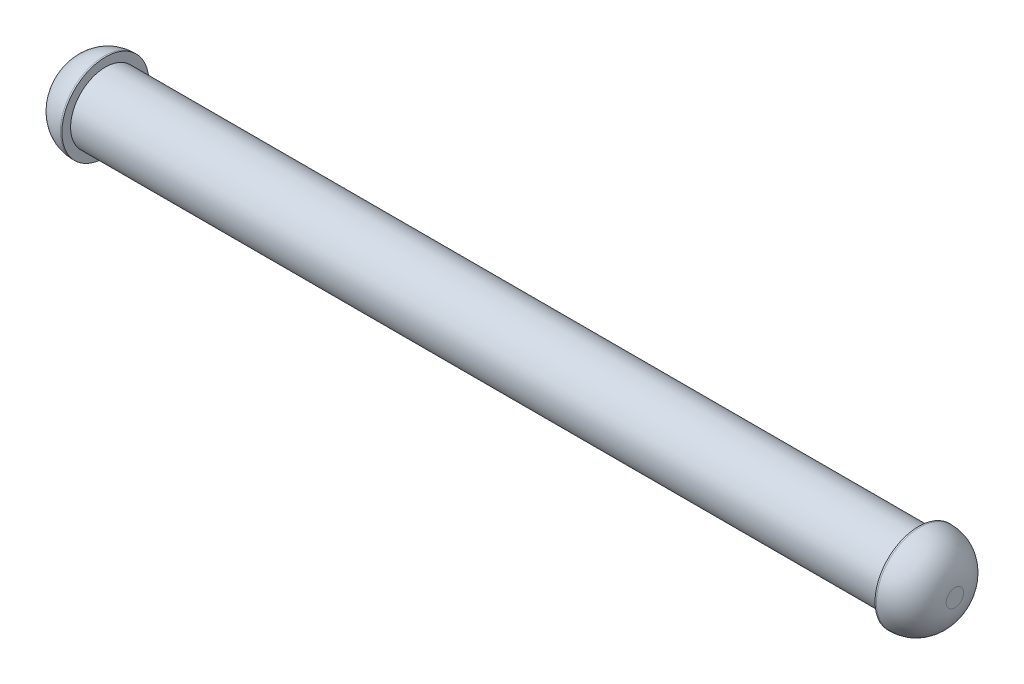
from build123d import *

# Parameters (mm, degrees)
FILLET1_R = 6


with BuildPart() as part:
    # Sketch1 → Revolve1 (revolve)
    with BuildSketch(Plane(origin=(0, 0, 0), x_dir=(1, 0, 0), z_dir=(0, 1, 0))):
        Polygon((-76.25, 0), (-76.25, 7.5), (-70, 7.5), (-70, 6), (70, 6), (70, 7.5), (76.25, 7.5), (76.25, 0), align=None)
    revolve(axis=Axis((-76.25, 0, 0), (1, 0, 0)))

    # Fillet1
    fillet1_edges = [part.edges().sort_by_distance(p)[0] for p in [
        (-76.25, 0, 7.5),
        (76.25, 0, 7.5),
    ]]
    fillet(fillet1_edges, radius=FILLET1_R)


solid = part.part
